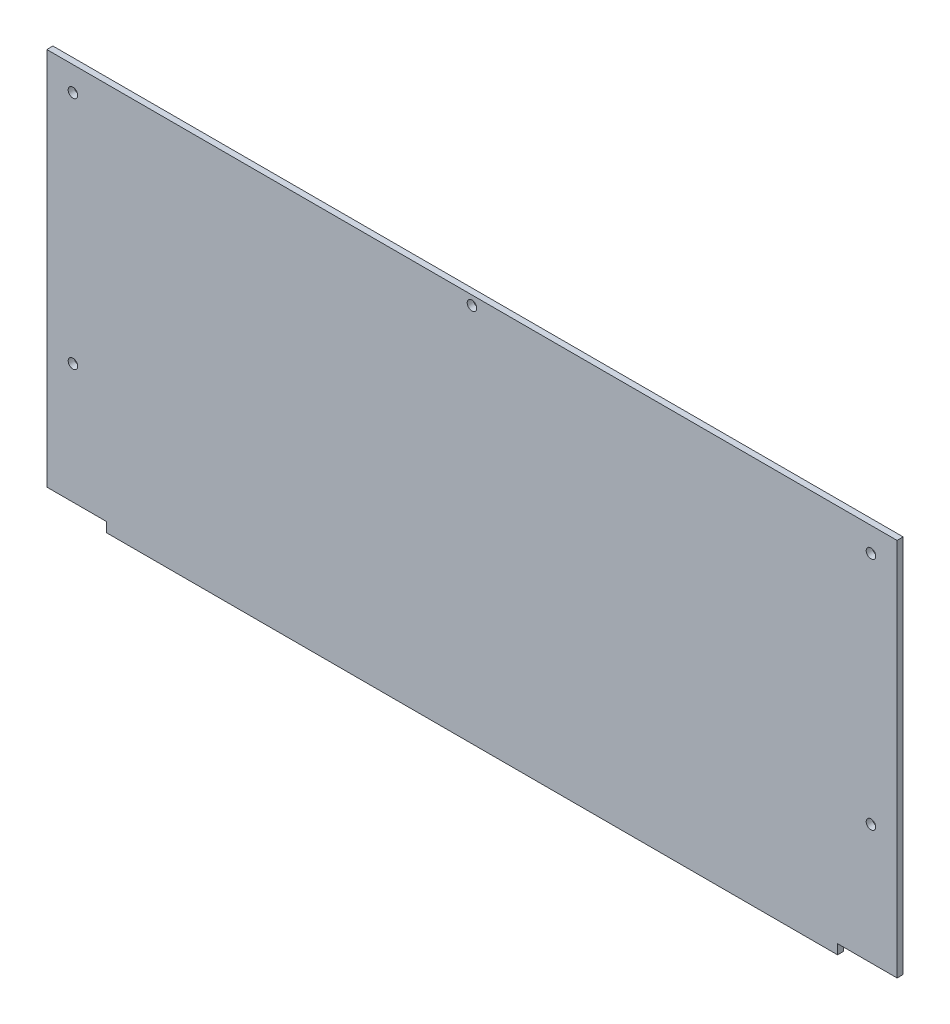
from build123d import *

# Parameters (mm, degrees)
SKETCH3_W              = 444.5
SKETCH3_H              = 203.2
BOSS_EXTRUDE1_DEPTH    = 1.5875
SKETCH4_W              = 31.115
SKETCH4_H              = 5.08
CUT_EXTRUDE1_DEPTH     = 245.392518554
F_10_CLEARANCE_HOLE1_D = 4.9784
F_10_CLEARANCE_HOLE2_D = 4.9784


with BuildPart() as part:
    # Sketch3 → Boss-Extrude1 (new, symmetric)
    with BuildSketch(Plane.XY):
        Rectangle(SKETCH3_W, SKETCH3_H)
    extrude(amount=BOSS_EXTRUDE1_DEPTH, both=True)

    # Sketch4 → Cut-Extrude1 (cut, through all)
    with BuildSketch(Plane(origin=(0, 0, -1.5875), x_dir=(-1, 0, 0), z_dir=(0, 0, -1))):
        with Locations((-206.6925, -99.06)):
            Rectangle(SKETCH4_W, SKETCH4_H)
        with Locations((206.6925, -99.06)):
            Rectangle(SKETCH4_W, SKETCH4_H)
    extrude(amount=-CUT_EXTRUDE1_DEPTH, mode=Mode.SUBTRACT)

    # #10 Clearance Hole1 (through all)
    with Locations(Plane(origin=(0, 0, -1.5875), x_dir=(-1, 0, 0), z_dir=(0, 0, -1))):
        with Locations((-208.5975, 88.9), (-208.5975, -33.782), (208.5975, 88.9), (208.5975, -33.782)):
            Hole(F_10_CLEARANCE_HOLE1_D / 2)

    # #10 Clearance Hole2 (through all)
    with Locations(Plane(origin=(0, 0, -1.5875), x_dir=(-1, 0, 0), z_dir=(0, 0, -1))):
        with Locations((0, 96.8375)):
            Hole(F_10_CLEARANCE_HOLE2_D / 2)


solid = part.part
